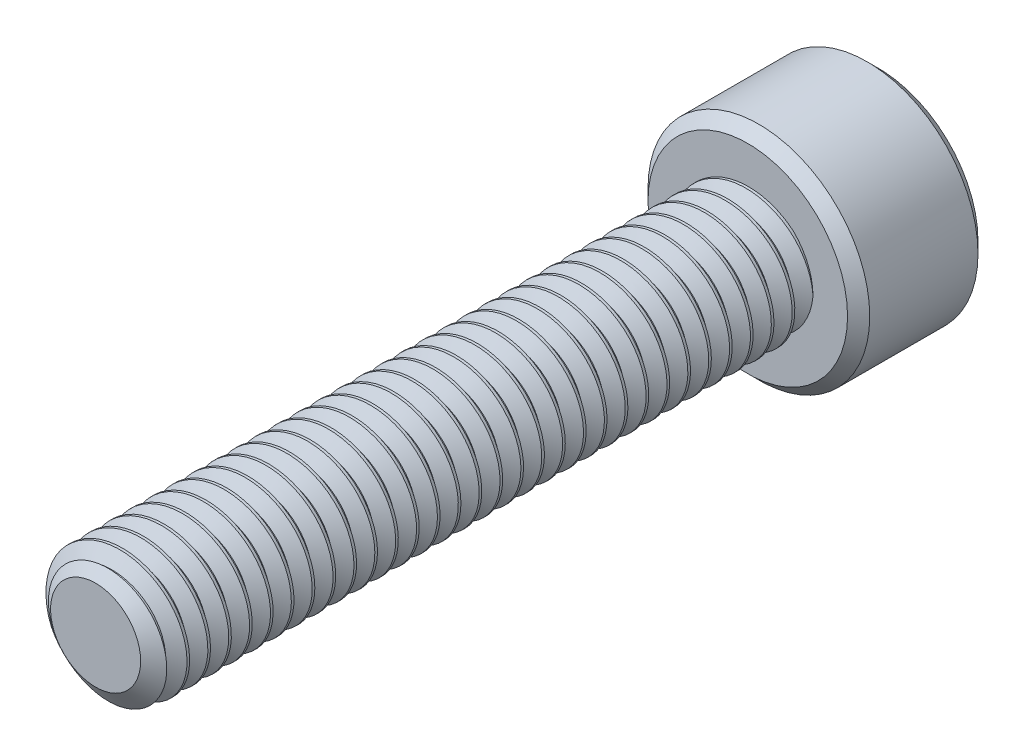
from build123d import *

# Parameters (mm, degrees)
SKETCH1_R          = 2.5
EXTRUDE1_DEPTH     = 25
CUT_SWEEP1_PITCH   = 0.8
SKETCH6_R          = 4.25
EXTRUDE2_DEPTH     = 5
CUT_EXTRUDE1_DEPTH = 3
CHAMFER1_SIZE      = 0.425


with BuildPart() as part:
    # Sketch1 → Extrude1 (new body)
    with BuildSketch(Plane.XY):
        Circle(SKETCH1_R)
    extrude(amount=-EXTRUDE1_DEPTH)

    # Cut-Sweep1: arcs per turn and ends read off the stored shape
    # Cut-Sweep1: the profile of Sketch3 profile screwed along a right-hand helix through 34 turns, 6 arcs to a turn; built about Z, then put on its axis
    cut_sweep1_z = Axis((0, 0, 0), (0, 0, 1))
    cut_sweep1_corners = [(2.5003, 0, -1.500173205), (1.980384758, 0, -1.2), (1.980384758, 0, -1.1), (2.5003, 0, -0.799826795)]
    with BuildLine(mode=Mode.PRIVATE) as cut_sweep1_profile:
        Line(cut_sweep1_corners[0], cut_sweep1_corners[1])
        Line(cut_sweep1_corners[1], cut_sweep1_corners[2])
        Line(cut_sweep1_corners[2], cut_sweep1_corners[3])
        Line(cut_sweep1_corners[3], cut_sweep1_corners[0])
    cut_sweep1_cap = Face(cut_sweep1_profile.wire())
    cut_sweep1_turn_angles = [0, 30, 60, 90, 120, 150, 180, 210, 240, 270, 300, 330, 360]
    cut_sweep1_turn_weights = [1, 0.8660254037844387, 1, 0.8660254037844387, 1, 0.8660254037844387, 1, 0.8660254037844387, 1, 0.8660254037844387, 1, 0.8660254037844387, 1]
    cut_sweep1_turn_rails = [Edge.make_bspline([Vector(p[0], p[1], 0).rotate(cut_sweep1_z, cut_sweep1_turn_angles[k]) / cut_sweep1_turn_weights[k] + Vector(0, 0, p[2] + CUT_SWEEP1_PITCH * cut_sweep1_turn_angles[k] / 360) for k in range(13)], [0, 0, 0, 1, 1, 2, 2, 3, 3, 4, 4, 5, 5, 6, 6, 6], 2, cut_sweep1_turn_weights) for p in cut_sweep1_corners]
    cut_sweep1_turn_sides = [Face.make_surface_from_curves(cut_sweep1_turn_rails[p[0]], cut_sweep1_turn_rails[p[1]]) for p in [(0, 1), (1, 2), (2, 3), (3, 0)]]
    cut_sweep1 = Plane(origin=(0, 0, 0), x_dir=(0, 1, 0), z_dir=(0, 0, -1)) * Solid(Shell([*[p.moved(Location((0, 0, CUT_SWEEP1_PITCH * i))) for i in range(34) for p in cut_sweep1_turn_sides], cut_sweep1_cap, cut_sweep1_cap.rotate(cut_sweep1_z, 12240).moved(Location((0, 0, CUT_SWEEP1_PITCH * 12240 / 360)))]))
    add(cut_sweep1, mode=Mode.SUBTRACT)

    # Sketch4 → Cut-Revolve1 (revolve, cut)
    with BuildSketch(Plane(origin=(0, 0, 0), x_dir=(0, 0, -1), z_dir=(1, 0, 0)), mode=Mode.PRIVATE) as cut_revolve1_sk:
        Polygon((0.541691224, 2.5), (0, 1.726384758), (0, 2.5), align=None)
    revolve(cut_revolve1_sk.sketch.rotate(Axis((0, 0, 0), (0, 0, -1)), 260.43858876), axis=Axis((0, 0, 0), (0, 0, -1)), mode=Mode.SUBTRACT)

    # Sketch6 → Extrude2 (add)
    with BuildSketch(Plane(origin=(0, 0, -25), x_dir=(-1, 0, 0), z_dir=(0, 0, -1))):
        Circle(SKETCH6_R)
    extrude(amount=EXTRUDE2_DEPTH)

    # Sketch7 → Cut-Extrude1 (cut)
    with BuildSketch(Plane(origin=(0, 0, -30), x_dir=(-1, 0, 0), z_dir=(0, 0, -1))):
        Polygon((0, 2.309401077), (-2, 1.154700538), (-2, -1.154700538), (0, -2.309401077), (2, -1.154700538), (2, 1.154700538), align=None)
    extrude(amount=-CUT_EXTRUDE1_DEPTH, mode=Mode.SUBTRACT)

    # Cut-Extrude2 cone 1 section (through the dimple's axis) → Cut-Extrude2 (revolve, cut)
    with BuildSketch(Plane(origin=(0, 0, -30), x_dir=(0, 1, 0), z_dir=(1, 0, 0))):
        Polygon((0, 0), (2.309401077, 0), (0, 2.309401077), align=None)
    revolve(axis=Axis((0, 0, -30), (0, 0, 1)), mode=Mode.SUBTRACT)

    # Chamfer1
    chamfer1_edges = [part.edges().sort_by_distance(p)[0] for p in [
        (4.25, 0, -25),
        (4.25, 0, -30),
    ]]
    chamfer(chamfer1_edges, length=CHAMFER1_SIZE)


solid = part.part
